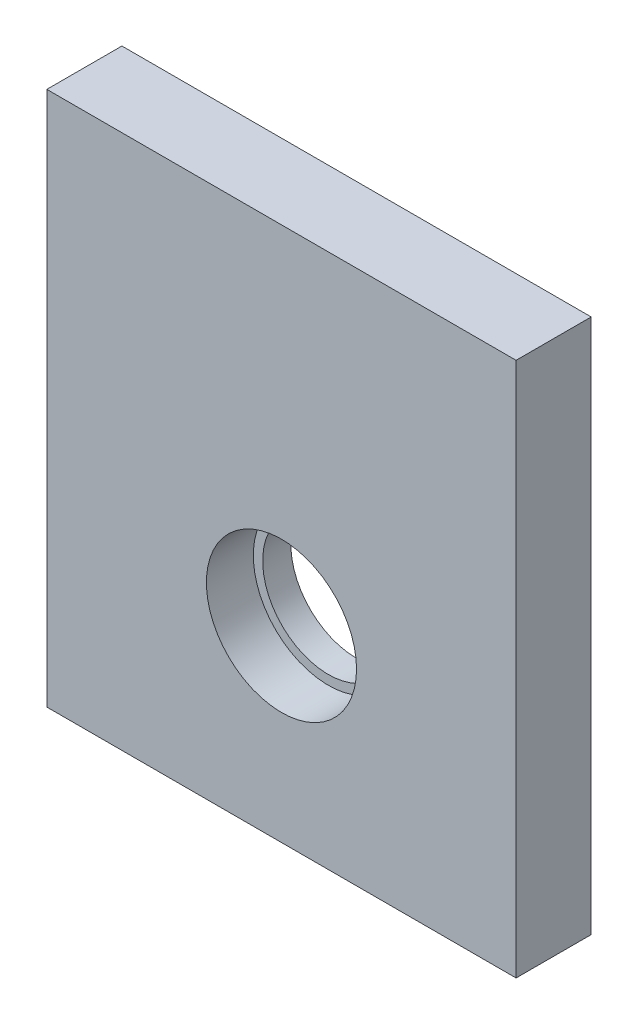
from build123d import *

# Parameters (mm, degrees)
ESQUISSE1_W             = 50
ESQUISSE1_H             = 57
ESQUISSE1_R             = 7
BOSS_EXTRU_1_DEPTH      = 8
ESQUISSE2_R             = 8
ENL_V_MAT_EXTRU_1_DEPTH = 5


with BuildPart() as part:
    # Esquisse1 → Boss.-Extru.1 (new body)
    with BuildSketch(Plane.XY):
        with Locations((25, 28.5)):
            Rectangle(ESQUISSE1_W, ESQUISSE1_H)
        with Locations((25, 20)):
            Circle(ESQUISSE1_R, mode=Mode.SUBTRACT)
    extrude(amount=BOSS_EXTRU_1_DEPTH)

    # Esquisse2 → Enlèv. mat.-Extru.1 (cut)
    with BuildSketch(Plane.XY.offset(8)):
        with Locations((25, 20)):
            Circle(ESQUISSE2_R)
    extrude(amount=-ENL_V_MAT_EXTRU_1_DEPTH, mode=Mode.SUBTRACT)


solid = part.part
